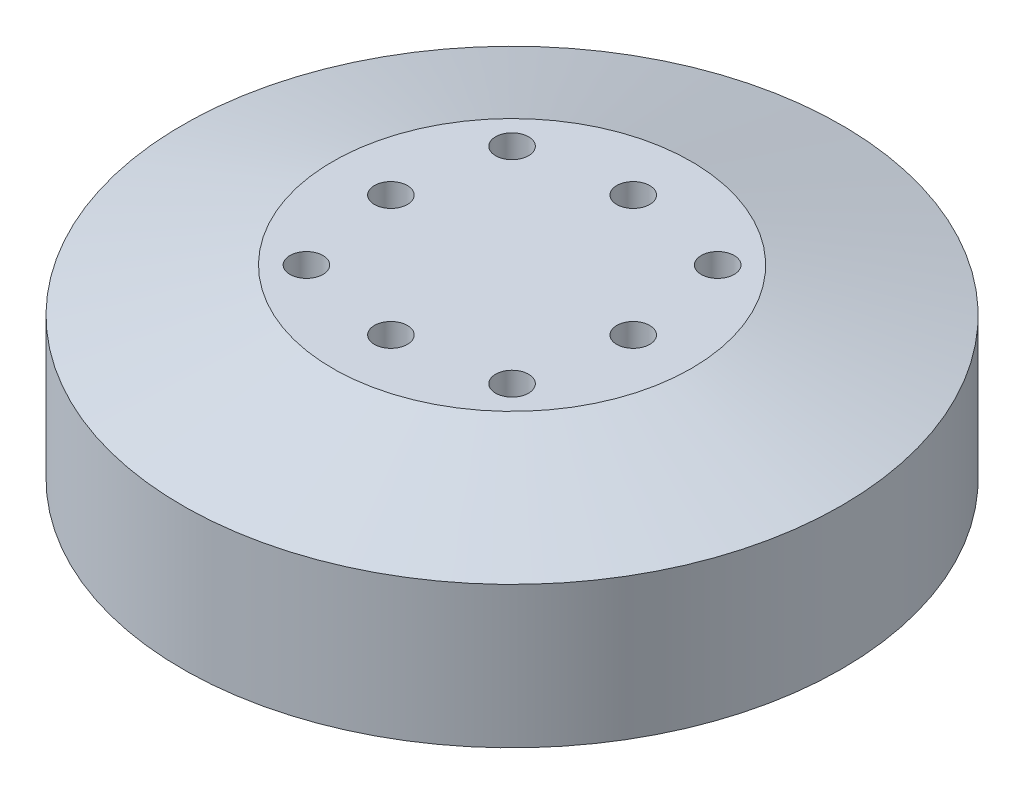
from build123d import *

# Parameters (mm, degrees)
M3_CLEARANCE_HOLE1_D     = 3.4
M3_CLEARANCE_HOLE1_DEPTH = 4
M3_CLEARANCE_HOLE1_TIP   = 1.021463052
SKETCH5_R                = 32
CUT_EXTRUDE1_DEPTH       = 1


with BuildPart() as part:
    # Sketch1 → Revolve1 (revolve)
    with BuildSketch(Plane.XY):
        Polygon((0, -9.55), (0, 9.55), (-18.5, 9.55), (-34, 5.05), (-34, -9.55), align=None)
    revolve(axis=Axis((0, -9.55, 0), (0, 1, 0)))

    # M3 Clearance Hole1
    with Locations(Plane(origin=(0, 9.55, 0), x_dir=(1, 0, 0), z_dir=(0, 1, 0))):
        with Locations((-10.606601718, 10.606601718), (0, 12.5), (10.606601718, 10.606601718), (12.5, 0), (10.606601718, -10.606601718), (-10.606601718, -10.606601718), (-12.5, 0), (0, -12.5)):
            Hole(M3_CLEARANCE_HOLE1_D / 2, depth=M3_CLEARANCE_HOLE1_DEPTH)
            with Locations((0, 0, -(M3_CLEARANCE_HOLE1_DEPTH + M3_CLEARANCE_HOLE1_TIP / 2))):  # 118° drill point
                Cone(0, M3_CLEARANCE_HOLE1_D / 2, M3_CLEARANCE_HOLE1_TIP, mode=Mode.SUBTRACT)

    # Sketch5 → Cut-Extrude1 (cut)
    with BuildSketch(Plane.XZ.offset(9.55)):
        Circle(SKETCH5_R)
    extrude(amount=-CUT_EXTRUDE1_DEPTH, mode=Mode.SUBTRACT)


solid = part.part
